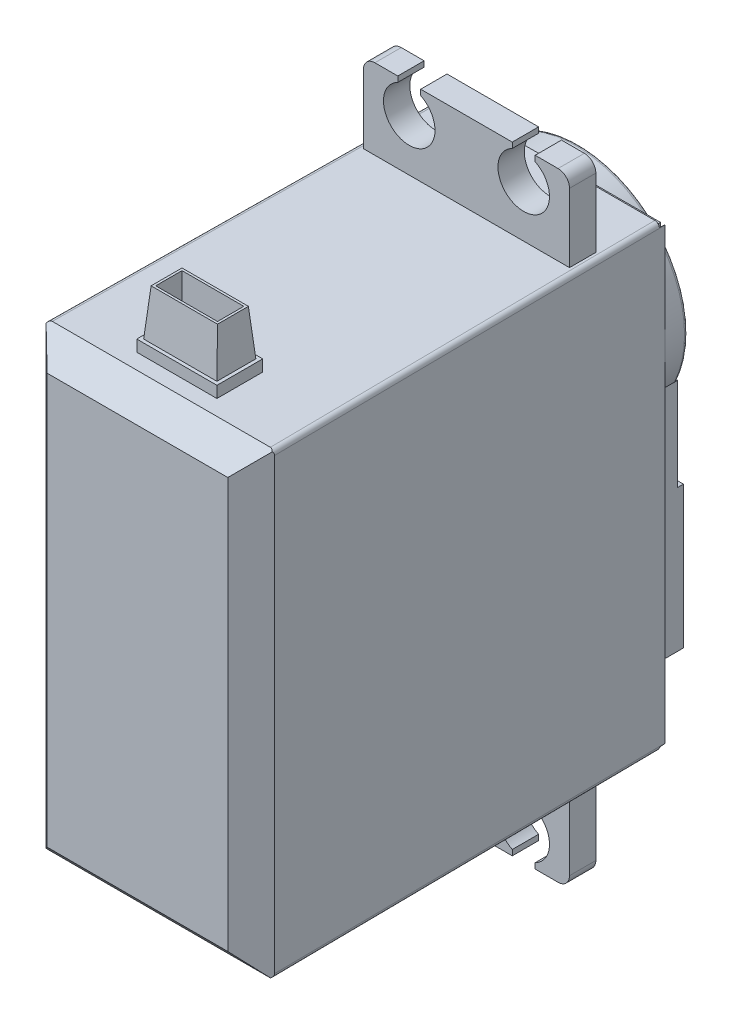
from build123d import *
from OCP.BRepFilletAPI import BRepFilletAPI_MakeChamfer

# Parameters (mm, degrees)
SALIENTE_EXTRUIR1_DEPTH       = 40
CROQUIS2_W                    = 19.1
CROQUIS2_H                    = 40
CROQUIS2_W_2                  = 18.3
CROQUIS2_H_2                  = 39.2
CORTAR_EXTRUIR1_DEPTH         = 0.5
CROQUIS3_W                    = 17.3
CROQUIS3_H                    = 20.502778731
SALIENTE_EXTRUIR5_DEPTH       = 2
SALIENTE_EXTRUIR10_DEPTH      = 2.5
SALIENTE_EXTRUIR11_DEPTH      = 1.7
SALIENTE_EXTRUIR12_DEPTH      = 0.5
SALIENTE_EXTRUIR14_DEPTH      = 1.4
SALIENTE_EXTRUIR14_DEPTH_BACK = 1.4
CROQUIS7_R                    = 6.5
CROQUIS8_R                    = 5.25
SALIENTE_EXTRUIR15_DEPTH      = 0.6
CROQUIS9_W                    = 18
CROQUIS9_H                    = 2.3
SALIENTE_EXTRUIR16_DEPTH      = 7
CROQUIS10_W                   = 18
CROQUIS10_H                   = 2.3
SALIENTE_EXTRUIR17_DEPTH      = 7
CORTAR_EXTRUIR2_DEPTH         = 58.229472302
CROQUIS12_W                   = 0.9
CROQUIS12_H                   = 7
SALIENTE_EXTRUIR18_DEPTH      = 1
CORTAR_EXTRUIR3_DEPTH         = 53.894695006
CROQUIS14_W                   = 15.3
CROQUIS14_H                   = 10.4
CORTAR_EXTRUIR4_DEPTH         = 0.4
CROQUIS15_R                   = 3
CORTAR_EXTRUIR5_DEPTH         = 2
CROQUIS16_R                   = 1.1
CORTAR_EXTRUIR6_DEPTH         = 3
CROQUIS17_W                   = 7
CROQUIS17_H                   = 4
SALIENTE_EXTRUIR19_DEPTH      = 1
CROQUIS18_W                   = 6.4
CROQUIS18_H                   = 3.4
SALIENTE_EXTRUIR20_DEPTH      = 4
CORTAR_EXTRUIR7_DEPTH         = 4
CORTAR_EXTRUIR9_DEPTH         = 54.577898986
CROQUIS23_W                   = 5.4
CROQUIS23_H                   = 2.3
CORTAR_EXTRUIR10_DEPTH        = 4
REDONDEO1_R                   = 1
REDONDEO2_R                   = 0.3
REDONDEO3_R                   = 0.2
CHAFL_N1_SIZE                 = 2
CHAFL_N1_SIZE2                = 2.14473742
CHAFL_N1_SIZE2_2              = 2.12001914
REDONDEO5_R                   = 0.4


with BuildPart() as part:
    # Croquis1 → Saliente-Extruir1 (new body)
    with BuildSketch(Plane(origin=(0, 0, 0), x_dir=(1, 0, 0), z_dir=(0, 1, 0))):
        Polygon((-9.55, 17.924615385), (9.55, 17.924615385), (9.95, -18.675384615), (-9.95, -18.675384615), align=None)
    extrude(amount=SALIENTE_EXTRUIR1_DEPTH)

    # Croquis2 → Cortar-Extruir1 (cut)
    with BuildSketch(Plane(origin=(0, 0, -17.924615385), x_dir=(-1, 0, 0), z_dir=(0, 0, -1))):
        with Locations((0, 20)):
            Rectangle(CROQUIS2_W, CROQUIS2_H)
        with Locations((0, 20)):
            Rectangle(CROQUIS2_W_2, CROQUIS2_H_2, mode=Mode.SUBTRACT)
    extrude(amount=-CORTAR_EXTRUIR1_DEPTH, mode=Mode.SUBTRACT)

    # Croquis3 → Saliente-Extruir5 (add)
    with BuildSketch(Plane(origin=(0, 0, -17.924615385), x_dir=(-1, 0, 0), z_dir=(0, 0, -1))):
        with Locations((0, 16.151389366)):
            Rectangle(CROQUIS3_W, CROQUIS3_H)
    extrude(amount=SALIENTE_EXTRUIR5_DEPTH)

    # Croquis5 → Saliente-Extruir11 (add)
    with BuildSketch(Plane(origin=(0, 0, -17.924615385), x_dir=(-1, 0, 0), z_dir=(0, 0, -1))):
        with BuildLine():
            Line((-4.65, 5.9), (4.65, 5.9))
            ThreePointArc((4.65, 5.9), (0, 3.9), (-4.65, 5.9))
        make_face()
    extrude(amount=SALIENTE_EXTRUIR11_DEPTH)

    # Croquis6 → Saliente-Extruir12 (add)
    with BuildSketch(Plane(origin=(0, 0, -19.924615385), x_dir=(-1, 0, 0), z_dir=(0, 0, -1))):
        with BuildLine():
            Line((-8.65, 5.9), (8.65, 5.9))
            Line((8.65, 5.9), (8.65, 18.3))
            Line((8.65, 18.3), (1.802775638, 18.3))
            ThreePointArc((1.802775638, 18.3), (0, 20.8), (-1.802775638, 18.3))
            Line((-1.802775638, 18.3), (-8.65, 18.3))
            Line((-8.65, 18.3), (-8.65, 5.9))
        make_face()
    extrude(amount=SALIENTE_EXTRUIR12_DEPTH)

    # Croquis9 → Saliente-Extruir16 (add)
    with BuildSketch(Plane(origin=(0, 40, 0), x_dir=(1, 0, 0), z_dir=(0, 1, 0))):
        with Locations((0, 11.274615385)):
            Rectangle(CROQUIS9_W, CROQUIS9_H)
    extrude(amount=SALIENTE_EXTRUIR16_DEPTH)

    # Croquis10 → Saliente-Extruir17 (add)
    with BuildSketch(Plane.XZ):
        with Locations((0, -11.274615385)):
            Rectangle(CROQUIS10_W, CROQUIS10_H)
    extrude(amount=SALIENTE_EXTRUIR17_DEPTH)

    # Croquis11 → Cortar-Extruir2 (cut, through all)
    with BuildSketch(Plane(origin=(0, 0, -12.424615385), x_dir=(-1, 0, 0), z_dir=(0, 0, -1))):
        with BuildLine():
            Line((-6, 46.515564437), (-6, 47.543757467))
            Line((-6, 47.543757467), (-4, 47.543757467))
            Line((-4, 47.543757467), (-4, 46.515564437))
            ThreePointArc((-4, 46.515564437), (-5, 42.25), (-6, 46.515564437))
        make_face()
        with BuildLine():
            Line((4, 46.515564437), (4, 47.543757467))
            Line((4, 47.543757467), (6, 47.543757467))
            Line((6, 47.543757467), (6, 46.515564437))
            ThreePointArc((6, 46.515564437), (5, 42.25), (4, 46.515564437))
        make_face()
        with BuildLine():
            Line((6, -6.515564437), (6, -7.543757467))
            Line((6, -7.543757467), (4, -7.543757467))
            Line((4, -7.543757467), (4, -6.515564437))
            ThreePointArc((4, -6.515564437), (5, -2.25), (6, -6.515564437))
        make_face()
        with BuildLine():
            Line((-4, -6.515564437), (-4, -7.543757467))
            Line((-4, -7.543757467), (-6, -7.543757467))
            Line((-6, -7.543757467), (-6, -6.515564437))
            ThreePointArc((-6, -6.515564437), (-5, -2.25), (-4, -6.515564437))
        make_face()
    extrude(amount=-CORTAR_EXTRUIR2_DEPTH, mode=Mode.SUBTRACT)

    # Croquis12 → Saliente-Extruir18 (add)
    with BuildSketch(Plane(origin=(0, 0, -12.424615385), x_dir=(-1, 0, 0), z_dir=(0, 0, -1))):
        with Locations((0, -3.5)):
            Rectangle(CROQUIS12_W, CROQUIS12_H)
        with Locations((0, 43.5)):
            Rectangle(CROQUIS12_W, CROQUIS12_H)
    extrude(amount=SALIENTE_EXTRUIR18_DEPTH)

    # Croquis13 → Cortar-Extruir3 (cut, through all)
    with BuildSketch(Plane.ZY.offset(0.45)):
        Polygon((-13.424615385, 40), (-12.424615385, 47), (-13.424615385, 47), align=None)
        Polygon((-13.424615385, 0), (-12.424615385, -7), (-13.424615385, -7), align=None)
    extrude(amount=-CORTAR_EXTRUIR3_DEPTH, mode=Mode.SUBTRACT)

    # Croquis14 → Cortar-Extruir4 (cut)
    with BuildSketch(Plane(origin=(0, 0, -20.424615385), x_dir=(-1, 0, 0), z_dir=(0, 0, -1))):
        with Locations((0, 12.1)):
            Rectangle(CROQUIS14_W, CROQUIS14_H)
    extrude(amount=-CORTAR_EXTRUIR4_DEPTH, mode=Mode.SUBTRACT)


with BuildPart() as body_2:
    # Croquis4 → Saliente-Extruir10 (new body)
    with BuildSketch(Plane(origin=(0, 0, -17.424615385), x_dir=(-1, 0, 0), z_dir=(0, 0, -1))):
        with BuildLine():
            Line((-8.65, 26.402778731), (8.65, 26.402778731))
            ThreePointArc((8.65, 26.402778731), (0, 40), (-8.65, 26.402778731))
        make_face()
    extrude(amount=SALIENTE_EXTRUIR10_DEPTH)


with BuildPart() as body_3:
    # Croquis7 → Saliente-Extruir14 (new, two sides: drawn at the far end of the back side and taken through both)
    with BuildSketch(Plane(origin=(0, 0, -19.924615385), x_dir=(-1, 0, 0), z_dir=(0, 0, -1)).offset(-SALIENTE_EXTRUIR14_DEPTH_BACK)):
        with Locations((0, 30.45)):
            Circle(CROQUIS7_R)
    extrude(amount=SALIENTE_EXTRUIR14_DEPTH + SALIENTE_EXTRUIR14_DEPTH_BACK)

    # Croquis8 → Saliente-Extruir15 (add)
    with BuildSketch(Plane(origin=(0, 0, -21.324615385), x_dir=(-1, 0, 0), z_dir=(0, 0, -1))):
        with Locations((0, 30.45)):
            Circle(CROQUIS8_R)
    extrude(amount=SALIENTE_EXTRUIR15_DEPTH)

    # Croquis15 → Cortar-Extruir5 (cut)
    with BuildSketch(Plane(origin=(0, 0, -21.924615385), x_dir=(-1, 0, 0), z_dir=(0, 0, -1))):
        with Locations((0, 30.45)):
            Circle(CROQUIS15_R)
    extrude(amount=-CORTAR_EXTRUIR5_DEPTH, mode=Mode.SUBTRACT)


with BuildPart() as cortar_extruir6_tool:
    # Croquis16 → Cortar-Extruir6 (new body)
    with BuildSketch(Plane(origin=(0, 0, -19.924615385), x_dir=(-1, 0, 0), z_dir=(0, 0, -1))):
        with Locations((0, 30.45)):
            Circle(CROQUIS16_R)
    extrude(amount=-CORTAR_EXTRUIR6_DEPTH)


with BuildPart() as part_1:
    add(part.part)

    # Cortar-Extruir6: cut by cortar_extruir6_tool
    add(cortar_extruir6_tool.part, mode=Mode.SUBTRACT)

    # Croquis17 → Saliente-Extruir19 (add)
    with BuildSketch(Plane(origin=(0, 40, 0), x_dir=(1, 0, 0), z_dir=(0, 1, 0))):
        with Locations((0, -13.175384615)):
            Rectangle(CROQUIS17_W, CROQUIS17_H)
    extrude(amount=SALIENTE_EXTRUIR19_DEPTH)

    # Croquis18 → Saliente-Extruir20 (add)
    with BuildSketch(Plane(origin=(0, 41, 0), x_dir=(1, 0, 0), z_dir=(0, 1, 0))):
        with Locations((0, -13.175384615)):
            Rectangle(CROQUIS18_W, CROQUIS18_H)
    extrude(amount=SALIENTE_EXTRUIR20_DEPTH)

    # Croquis20 → Cortar-Extruir7 (cut)
    with BuildSketch(Plane.XY.offset(14.875384615)):
        Polygon((-2.9, 45), (2.9, 45), (3.2, 41), (3.2, 45.300749245), (-3.2, 45.300749245), (-3.2, 41), align=None)
    extrude(amount=-CORTAR_EXTRUIR7_DEPTH, mode=Mode.SUBTRACT)

    # Croquis22 → Cortar-Extruir9 (cut, through all)
    with BuildSketch(Plane(origin=(3.5, 0, 0), x_dir=(0, 0, -1), z_dir=(1, 0, 0))):
        Polygon((-14.525384615, 45), (-11.825384615, 45), (-11.475384615, 41), (-11.475384615, 45.799584753), (-14.875384615, 45.799584753), (-14.875384615, 41), align=None)
    extrude(amount=-CORTAR_EXTRUIR9_DEPTH, mode=Mode.SUBTRACT)

    # Croquis23 → Cortar-Extruir10 (cut)
    with BuildSketch(Plane(origin=(0, 45, 0), x_dir=(1, 0, 0), z_dir=(0, 1, 0))):
        with Locations((0, -13.175384615)):
            Rectangle(CROQUIS23_W, CROQUIS23_H)
    extrude(amount=-CORTAR_EXTRUIR10_DEPTH, mode=Mode.SUBTRACT)

    # Redondeo1
    redondeo1_edges = [part_1.edges().sort_by_distance(p)[0] for p in [
        (9, 47, -11.274615385),
        (-9, 47, -11.274615385),
        (9, -7, -11.274615385),
        (-9, -7, -11.274615385),
    ]]
    fillet(redondeo1_edges, radius=REDONDEO1_R)

    # Chaflán1: one chamfer whose edges measure the first distance from different faces: ONE call of the kernel's chamfer builder (chamfer() names one face for all edges)
    chafl_n1_edges_1 = [part_1.edges().sort_by_distance(p)[0] for p in [
        (0, 40, 18.675384615),
    ]]
    chafl_n1_side_1 = [part_1.faces().sort_by_distance(p)[0] for p in [
        (0, 20, 18.675384615),
    ]]
    chafl_n1_edges_2 = [part_1.edges().sort_by_distance(p)[0] for p in [
        (0, 0, 18.675384615),
    ]]
    chafl_n1_side_2 = [part_1.faces().sort_by_distance(p)[0] for p in [
        (0, 0, 1.517579221),
    ]]
    chafl_n1_edges_3 = [part_1.edges().sort_by_distance(p)[0] for p in [
        (9.95, 20, 18.675384615),
    ]]
    chafl_n1_side_3 = [part_1.faces().sort_by_distance(p)[0] for p in [
        (0, 20, 18.675384615),
    ]]
    chafl_n1_edges_4 = [part_1.edges().sort_by_distance(p)[0] for p in [
        (-9.95, 20, 18.675384615),
    ]]
    chafl_n1_side_4 = [part_1.faces().sort_by_distance(p)[0] for p in [
        (-9.75, 20, 0.375384615),
    ]]
    chafl_n1 = BRepFilletAPI_MakeChamfer(part_1.part.solid().wrapped)
    for e in chafl_n1_edges_1:
        chafl_n1.Add(CHAFL_N1_SIZE, CHAFL_N1_SIZE2, e.wrapped, chafl_n1_side_1[0].wrapped)  # the first distance lies on this face
    for e in chafl_n1_edges_2:
        chafl_n1.Add(CHAFL_N1_SIZE, CHAFL_N1_SIZE2, e.wrapped, chafl_n1_side_2[0].wrapped)  # the first distance lies on this face
    for e in chafl_n1_edges_3:
        chafl_n1.Add(CHAFL_N1_SIZE, CHAFL_N1_SIZE2_2, e.wrapped, chafl_n1_side_3[0].wrapped)  # the first distance lies on this face
    for e in chafl_n1_edges_4:
        chafl_n1.Add(CHAFL_N1_SIZE, CHAFL_N1_SIZE2_2, e.wrapped, chafl_n1_side_4[0].wrapped)  # the first distance lies on this face
    add(Compound.cast(chafl_n1.Shape()), mode=Mode.REPLACE)

    # Redondeo5
    # the kernel refuses this fillet: 0.4 mm, written as the material it takes off along each edge
    with BuildSketch(Plane(origin=(9.599180328, 0, -13.424615385), x_dir=(-0.999940284246931, 0, 0.010928309117452758), z_dir=(0.01092830911745276, 0, 0.9999402842469312))) as redondeo5_piece_1:
        with BuildLine():
            CenterArc((REDONDEO5_R, -REDONDEO5_R), REDONDEO5_R, 90, 90)
            Line((0, -REDONDEO5_R), (0, 0))
            Line((0, 0), (REDONDEO5_R, 0))
        make_face()
    extrude(amount=30.981897851, mode=Mode.SUBTRACT)
    with BuildSketch(Plane(origin=(-9.939070386, 0, 17.6753249), x_dir=(0.999940284246931, 0, 0.010928309117452758), z_dir=(0.01092830911745276, 0, -0.9999402842469312))) as redondeo5_piece_2:
        with BuildLine():
            CenterArc((REDONDEO5_R, -REDONDEO5_R), REDONDEO5_R, 90, 90)
            Line((0, -REDONDEO5_R), (0, 0))
            Line((0, 0), (REDONDEO5_R, 0))
        make_face()
    extrude(amount=36.602066288, mode=Mode.SUBTRACT)
    with BuildSketch(Plane(origin=(-9.937488556, 40, 17.53058748), x_dir=(0, -1, 0), z_dir=(0.01092830911745276, 0, -0.9999402842469312))) as redondeo5_piece_3:
        with BuildLine():
            CenterArc((REDONDEO5_R, -REDONDEO5_R), REDONDEO5_R, 90, 90)
            Line((0, -REDONDEO5_R), (0, 0))
            Line((0, 0), (REDONDEO5_R, 0))
        make_face()
    extrude(amount=36.457320225, mode=Mode.SUBTRACT)
    with BuildSketch(Plane(origin=(9.599180328, 40, -13.424615385), x_dir=(0, -1, 0), z_dir=(0.01092830911745276, 0, 0.9999402842469312))) as redondeo5_piece_4:
        with BuildLine():
            CenterArc((REDONDEO5_R, -REDONDEO5_R), REDONDEO5_R, 90, 90)
            Line((0, -REDONDEO5_R), (0, 0))
            Line((0, 0), (REDONDEO5_R, 0))
        make_face()
    extrude(amount=30.957051488, mode=Mode.SUBTRACT)
    with BuildSketch(Plane(origin=(9.539071691, 40, -18.924555669), x_dir=(0, -1, 0), z_dir=(0.01092830911745276, 0, 0.9999402842469312)), Plane(origin=(9.539071691, 0, -18.924555669), x_dir=(-0.999940284246931, 0, 0.010928309117452758), z_dir=(0.01092830911745276, 0, 0.9999402842469312))) as redondeo5_piece_5:
        with BuildLine():
            CenterArc((REDONDEO5_R, -REDONDEO5_R), REDONDEO5_R, 90, 90)
            Line((0, -REDONDEO5_R), (0, 0))
            Line((0, 0), (REDONDEO5_R, 0))
        make_face()
    extrude(amount=5.500268737, mode=Mode.SUBTRACT)


with BuildPart() as body_2_1:
    add(body_2.part)

    # Cortar-Extruir6: cut by cortar_extruir6_tool
    add(cortar_extruir6_tool.part, mode=Mode.SUBTRACT)

    # Redondeo2
    redondeo2_edges = [body_2_1.edges().sort_by_distance(p)[0] for p in [
        (0, 40, -19.924615385),
    ]]
    fillet(redondeo2_edges, radius=REDONDEO2_R)


with BuildPart() as body_3_1:
    add(body_3.part)

    # Cortar-Extruir6: cut by cortar_extruir6_tool
    add(cortar_extruir6_tool.part, mode=Mode.SUBTRACT)

    # Redondeo3
    redondeo3_edges = [body_3_1.edges().sort_by_distance(p)[0] for p in [
        (6.5, 30.45, -21.324615385),
        (5.25, 30.45, -21.924615385),
    ]]
    fillet(redondeo3_edges, radius=REDONDEO3_R)


solid = Compound([part_1.part, body_2_1.part, body_3_1.part])
